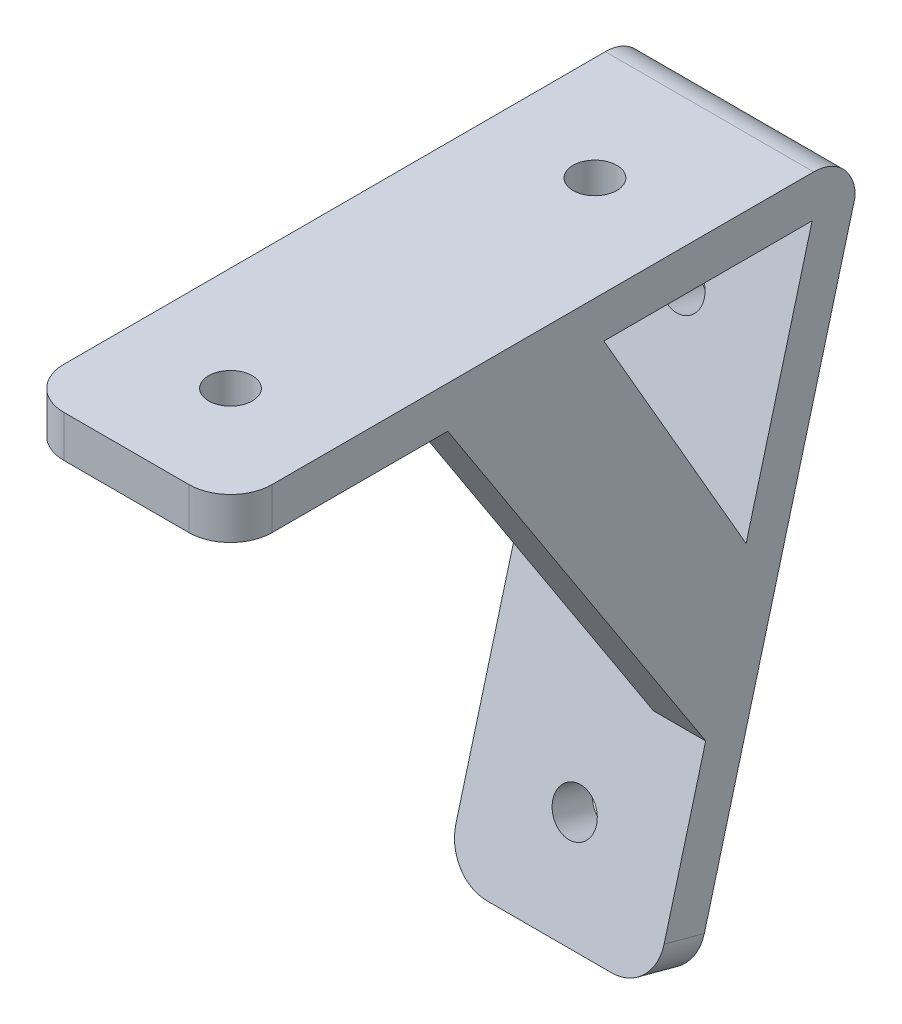
from build123d import *

# Parameters (mm, degrees)
SKETCH1_W           = 20
SKETCH1_H           = 60
BOSS_EXTRUDE1_DEPTH = 4
SKETCH6_W           = 20
SKETCH6_H           = 60
BOSS_EXTRUDE3_DEPTH = 4
FILLET6_R           = 4
SKETCH7_R           = 2.1
CUT_EXTRUDE3_DEPTH  = 4
SKETCH8_R           = 2.1
CUT_EXTRUDE4_DEPTH  = 4
FILLET7_R           = 4
FILLET8_R           = 4
FILLET9_R           = 4
FILLET10_R          = 4
BOSS_EXTRUDE5_DEPTH = 5


with BuildPart() as part:
    # Sketch1 → Boss-Extrude1 (new body)
    with BuildSketch(Plane(origin=(0, 0, 0), x_dir=(1, 0, 0), z_dir=(0, 1, 0))):
        Rectangle(SKETCH1_W, SKETCH1_H)
    extrude(amount=BOSS_EXTRUDE1_DEPTH)

    # Sketch6 → Boss-Extrude3 (add)
    with BuildSketch(Plane(origin=(0, -7.5, -27.990381057), x_dir=(-1, 0, 0), z_dir=(0, -0.25881904510251796, -0.9659258262890691))):
        with Locations((0, -22.235428647)):
            Rectangle(SKETCH6_W, SKETCH6_H)
    extrude(amount=-BOSS_EXTRUDE3_DEPTH)

    # Fillet6
    fillet6_edges = [part.edges().sort_by_distance(p)[0] for p in [
        (0, 4, -30),
    ]]
    fillet(fillet6_edges, radius=FILLET6_R - 0.0001)  # a hair under: the kernel refuses the full size

    # Sketch7 → Cut-Extrude3 (cut)
    with BuildSketch(Plane.XZ):
        with Locations(Location((0, 20, 0), (0, 0, 270))):
            Circle(SKETCH7_R)
        with Locations(Location((0, -15, 0), (0, 0, 270))):
            Circle(SKETCH7_R)
    extrude(amount=-CUT_EXTRUDE3_DEPTH, mode=Mode.SUBTRACT)

    # Sketch8 → Cut-Extrude4 (cut)
    with BuildSketch(Plane(origin=(0, -6.46472382, -24.126677752), x_dir=(1, 0, 0), z_dir=(0, 0.25881904510251796, 0.9659258262890691))):
        with Locations(Location((0, -2.771327032, 0), (0, 0, 270))):
            Circle(SKETCH8_R)
        with Locations(Location((0, -42.771327032, 0), (0, 0, 270))):
            Circle(SKETCH8_R)
    extrude(amount=-CUT_EXTRUDE4_DEPTH, mode=Mode.SUBTRACT)

    # Fillet7
    fillet7_edges = [part.edges().sort_by_distance(p)[0] for p in [
        (-10, -57.437911487, -12.539005641),
    ]]
    fillet(fillet7_edges, radius=FILLET7_R)

    # Fillet8
    fillet8_edges = [part.edges().sort_by_distance(p)[0] for p in [
        (10, -57.437911487, -12.539005641),
    ]]
    fillet(fillet8_edges, radius=FILLET8_R)

    # Fillet9
    fillet9_edges = [part.edges().sort_by_distance(p)[0] for p in [
        (10, 2, 30),
    ]]
    fillet(fillet9_edges, radius=FILLET9_R)

    # Fillet10
    fillet10_edges = [part.edges().sort_by_distance(p)[0] for p in [
        (-10, 2, 30),
    ]]
    fillet(fillet10_edges, radius=FILLET10_R)

    # Brace → Boss-Extrude5 (add)
    with BuildSketch(Plane(origin=(10, 0, 0), x_dir=(0, 0, -1), z_dir=(1, 0, 0))):
        Polygon((15.63686364, -38.149141432), (-9.141104722, 0), (5.858895278, 0), (19.519149316, -23.660254038), align=None)
    extrude(amount=-BOSS_EXTRUDE5_DEPTH)


solid = part.part
